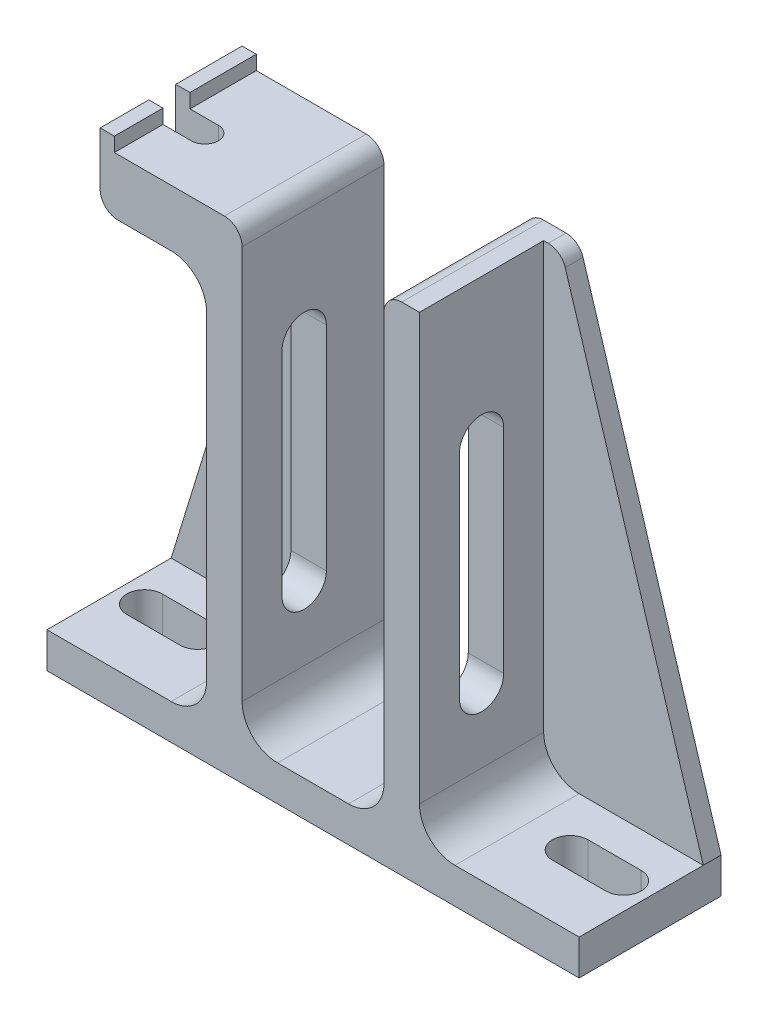
from build123d import *

# Parameters (mm, degrees)
BOSS_EXTRUDE1_DEPTH     = 12.7
RIB3_START              = -3.175
RIB3_DEPTH              = 3.175
CUT_EXTRUDE3_DEPTH      = 102.649597269
CUT_EXTRUDE3_DEPTH_BACK = 102.649597269
CUT_EXTRUDE4_DEPTH      = 102.649597269
SKETCH6_W               = 25.4
SKETCH6_H               = 12.7
BOSS_EXTRUDE2_DEPTH     = 19.05
CUT_EXTRUDE5_DEPTH      = 19.05
SKETCH9_W               = 22.86
SKETCH9_H               = 25.4
CUT_EXTRUDE6_DEPTH      = 2.54
FILLET4_R               = 3.175
FILLET5_R               = 6.35


# Read off the part's stored shape, not the designer's step: Rib3
with BuildPart() as part:
    # Sketch1 → Boss-Extrude1 (new, symmetric)
    with BuildSketch(Plane.XY):
        Polygon((-47.625, 0), (47.625, 0), (47.625, 6.35), (19.05, 6.35), (19.05, 88.9), (12.7, 88.9), (12.7, 6.35), (-12.7, 6.35), (-12.7, 88.9), (-19.05, 88.9), (-19.05, 6.35), (-47.625, 6.35), align=None)
    extrude(amount=BOSS_EXTRUDE1_DEPTH, both=True)

    # Rib3 outline → Rib3 (add)
    with BuildSketch(Plane(origin=(0, 0, -12.7), x_dir=(-1, 0, 0), z_dir=(0, 0, -1)).offset(RIB3_START)):
        Polygon((-19.05, 88.9), (-22.225, 88.9), (-47.625, 6.35), (-19.05, 6.35), align=None)
    rib3 = extrude(amount=RIB3_DEPTH)

    # Mirror1: Rib3 across plane
    add(rib3.mirror(Plane(origin=(0, 0, 0), x_dir=(0, 0, 1), z_dir=(1, 0, 0))))

    # Sketch4 → Cut-Extrude3 (cut, two sides: drawn at the far end of the back side and taken through both)
    with BuildSketch(Plane(origin=(0, 0, 0), x_dir=(0, 0, -1), z_dir=(1, 0, 0)).offset(-CUT_EXTRUDE3_DEPTH_BACK)):
        with BuildLine():
            Line((2.38125, 63.5), (2.38125, 25.4))
            ThreePointArc((2.38125, 25.4), (-1.5875, 21.43125), (-5.55625, 25.4))
            Line((-5.55625, 25.4), (-5.55625, 63.5))
            ThreePointArc((-5.55625, 63.5), (-1.5875, 67.46875), (2.38125, 63.5))
        make_face()
    extrude(amount=CUT_EXTRUDE3_DEPTH + CUT_EXTRUDE3_DEPTH_BACK, mode=Mode.SUBTRACT)

    # Sketch5 → Cut-Extrude4 (cut, through all)
    with BuildSketch(Plane.XZ):
        with BuildLine():
            Line((-42.8625, 3.175), (-33.3375, 3.175))
            ThreePointArc((-33.3375, 3.175), (-30.1625, 0), (-33.3375, -3.175))
            Line((-33.3375, -3.175), (-42.8625, -3.175))
            ThreePointArc((-42.8625, -3.175), (-46.0375, 0), (-42.8625, 3.175))
        make_face()
        with BuildLine():
            Line((42.8625, -3.175), (33.3375, -3.175))
            ThreePointArc((33.3375, -3.175), (30.1625, 0), (33.3375, 3.175))
            Line((33.3375, 3.175), (42.8625, 3.175))
            ThreePointArc((42.8625, 3.175), (46.0375, 0), (42.8625, -3.175))
        make_face()
    extrude(amount=-CUT_EXTRUDE4_DEPTH, mode=Mode.SUBTRACT)

    # Sketch6 → Boss-Extrude2 (add)
    with BuildSketch(Plane.ZY.offset(19.05)):
        with Locations((0, 82.55)):
            Rectangle(SKETCH6_W, SKETCH6_H)
    extrude(amount=BOSS_EXTRUDE2_DEPTH)

    # Sketch7 → Cut-Extrude5 (cut)
    with BuildSketch(Plane(origin=(0, 88.9, 0), x_dir=(1, 0, 0), z_dir=(0, 1, 0))):
        with BuildLine():
            Line((-30.48, -4.0005), (-43.18, -4.0005))
            ThreePointArc((-43.18, -4.0005), (-45.593, -1.5875), (-43.18, 0.8255))
            Line((-43.18, 0.8255), (-30.48, 0.8255))
            ThreePointArc((-30.48, 0.8255), (-28.067, -1.5875), (-30.48, -4.0005))
        make_face()
    extrude(amount=-CUT_EXTRUDE5_DEPTH, mode=Mode.SUBTRACT)

    # Sketch9 → Cut-Extrude6 (cut)
    with BuildSketch(Plane(origin=(0, 88.9, 0), x_dir=(1, 0, 0), z_dir=(0, 1, 0))):
        with Locations((-24.13, 0)):
            Rectangle(SKETCH9_W, SKETCH9_H)
    extrude(amount=-CUT_EXTRUDE6_DEPTH, mode=Mode.SUBTRACT)

    # Fillet4
    fillet4_edges = [part.edges().sort_by_distance(p)[0] for p in [
        (-38.1, 76.2, -6.76275),
        (-38.1, 76.2, 8.35025),
        (12.7, 88.9, 0),
        (-12.7, 86.36, 0),
        (22.225, 88.9, -11.1125),
    ]]
    fillet(fillet4_edges, radius=FILLET4_R)

    # Fillet5
    fillet5_edges = [part.edges().sort_by_distance(p)[0] for p in [
        (-26.132692308, 76.2, -11.1125),
        (-19.05, 76.2, 1.5875),
        (-19.05, 6.35, 1.5875),
        (-12.7, 6.35, 0),
        (12.7, 6.35, 0),
        (19.05, 6.35, 1.5875),
    ]]
    fillet(fillet5_edges, radius=FILLET5_R)


solid = part.part
